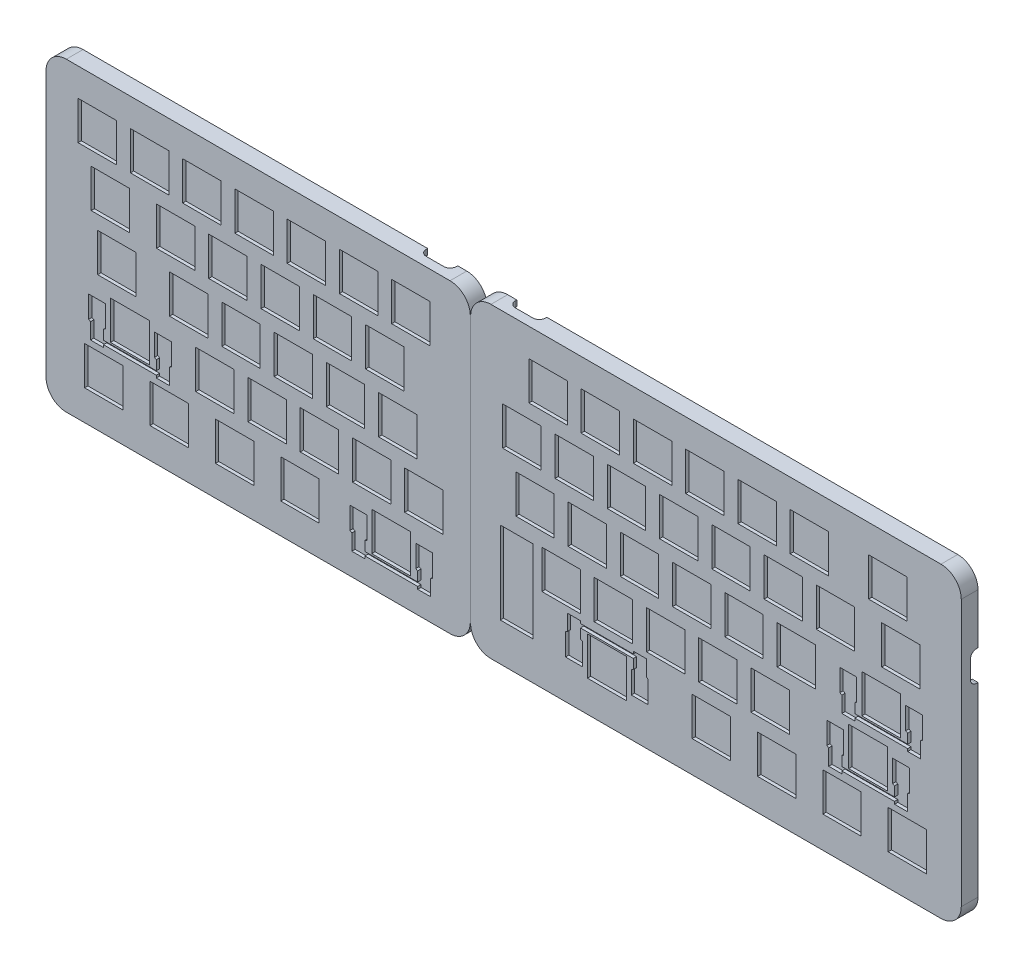
from build123d import *
from OCP.BRepAlgoAPI import BRepAlgoAPI_Cut
from OCP.TopTools import TopTools_ListOfShape

# Parameters (mm, degrees)
BOSS_EXTRUDE1_DEPTH                  = 1.2
BOSS_EXTRUDE1_2_DEPTH                = 1.2
SKETCH3_W                            = 14
SKETCH3_H                            = 14
CUT_EXTRUDE1_DEPTH                   = 1.2
BOSS_EXTRUDE2_DEPTH                  = 2.9
BOSS_EXTRUDE2_DEPTH_BACK             = 2
CUT_EXTRUDE2_DEPTH                   = 3.6
CUT_EXTRUDE3_DEPTH                   = 6
CUT_EXTRUDE4_START                   = -0.629226
CUT_EXTRUDE4_DEPTH                   = 2.133976
CUT_EXTRUDE5_DEPTH                   = 1.5
F_3_3_3_3_DIAMETER_HOLE1_AT_2_COUNT  = 2
F_3_3_3_3_DIAMETER_HOLE1_AT_2_PITCH  = 84.687594078
F_3_3_3_3_DIAMETER_HOLE1_AT_3_COUNT  = 2
F_3_3_3_3_DIAMETER_HOLE1_AT_3_PITCH  = 169.339250001
F_3_3_3_3_DIAMETER_HOLE1_AT_4_COUNT  = 2
F_3_3_3_3_DIAMETER_HOLE1_AT_4_PITCH  = 251.541091795
F_3_3_3_3_DIAMETER_HOLE1_AT_5_COUNT  = 2
F_3_3_3_3_DIAMETER_HOLE1_AT_5_PITCH  = 324.12
F_3_3_3_3_DIAMETER_HOLE1_AT_6_COUNT  = 2
F_3_3_3_3_DIAMETER_HOLE1_AT_6_PITCH  = 329.830375734
F_3_3_3_3_DIAMETER_HOLE1_AT_7_COUNT  = 2
F_3_3_3_3_DIAMETER_HOLE1_AT_7_PITCH  = 339.76617419
F_3_3_3_3_DIAMETER_HOLE1_AT_8_COUNT  = 2
F_3_3_3_3_DIAMETER_HOLE1_AT_8_PITCH  = 272.060494349
F_3_3_3_3_DIAMETER_HOLE1_AT_9_COUNT  = 2
F_3_3_3_3_DIAMETER_HOLE1_AT_9_PITCH  = 205.937809117
F_3_3_3_3_DIAMETER_HOLE1_AT_10_COUNT = 2
F_3_3_3_3_DIAMETER_HOLE1_AT_10_PITCH = 178.95
F_3_3_3_3_DIAMETER_HOLE1_AT_11_COUNT = 2
F_3_3_3_3_DIAMETER_HOLE1_AT_11_PITCH = 134.18391184
F_3_3_3_3_DIAMETER_HOLE1_AT_12_COUNT = 2
F_3_3_3_3_DIAMETER_HOLE1_AT_12_PITCH = 197.865862839
F_3_3_3_3_DIAMETER_HOLE1_AT_13_COUNT = 2
F_3_3_3_3_DIAMETER_HOLE1_AT_13_PITCH = 102.347999613
F_3_3_3_3_DIAMETER_HOLE1_AT_14_COUNT = 2
F_3_3_3_3_DIAMETER_HOLE1_AT_14_PITCH = 51.203766263
F_3_3_3_3_DIAMETER_HOLE1_AT_15_COUNT = 2
F_3_3_3_3_DIAMETER_HOLE1_AT_15_PITCH = 178.57853914
SKETCH11_W                           = 12.000000248
SKETCH11_H                           = 30
CUT_EXTRUDE_OLED_DEPTH               = 1.2
SKETCH13_W                           = 14.200000092
SKETCH13_H                           = 14.000000432
CUT_EXTRUDE6_DEPTH                   = 1.2
BOSS_EXTRUDE3_START                  = 1
BOSS_EXTRUDE3_DEPTH                  = 1


with BuildPart() as part:
    # Sketch2 → Boss-Extrude1 (new body)
    with BuildSketch(Plane.XY.offset(4.1)):
        with BuildLine():
            ThreePointArc((133.78, 95.545005864), (131.612590078, 100.777590078), (126.380005864, 102.945))
            Line((126.380005864, 102.945), (-13.490000824, 102.945))
            ThreePointArc((-13.490000824, 102.945), (-18.722587075, 100.77759308), (-20.89, 95.545009317))
            Line((-20.89, 95.545009317), (-20.89, -1.072999648))
            ThreePointArc((-20.89, -1.072999648), (-18.722593496, -6.305586659), (-13.490009317, -8.473))
            Line((-13.490009317, -8.473), (126.380000824, -8.473))
            ThreePointArc((126.380000824, -8.473), (131.612587075, -6.30559308), (133.78, -1.073009317))
            Line((133.78, -1.073009317), (133.78, 95.545005864))
        make_face()
    extrude(amount=-BOSS_EXTRUDE1_DEPTH)


with BuildPart() as body_2:
    # Sketch2 → Boss-Extrude1 2 (new body)
    with BuildSketch(Plane.XY.offset(4.1)):
        with BuildLine():
            ThreePointArc((141.290747469, 102.945), (136.058157566, 100.777589721), (133.89075, 95.544998695))
            Line((133.89075, 95.544998695), (133.89075002, -1.502703691))
            ThreePointArc((133.89075002, -1.502703691), (136.058071049, -6.735635188), (141.290974478, -8.903023987))
            Line((141.290974478, -8.903023987), (305.330003548, -8.903))
            ThreePointArc((305.330003548, -8.903), (310.562592793, -6.735589362), (312.73, -1.502998695))
            Line((312.73, -1.502998695), (312.73, 95.545002531))
            ThreePointArc((312.73, 95.545002531), (310.562589721, 100.777592434), (305.329998695, 102.945))
            Line((305.329998695, 102.945), (141.290747469, 102.945))
        make_face()
    extrude(amount=-BOSS_EXTRUDE1_2_DEPTH)


with BuildPart() as cut_extrude1_tool:
    # Sketch3 → Cut-Extrude1 (new body)
    with BuildSketch(Plane.XY.offset(4.1)):
        with Locations((245.45825, 9.525)):
            Rectangle(SKETCH3_W, SKETCH3_H)
        with Locations((221.64575, 9.525)):
            Rectangle(SKETCH3_W, SKETCH3_H)
        with Locations((183.54575, 9.525)):
            Rectangle(SKETCH3_W, SKETCH3_H)
        with Locations((78.767545, 28.582)):
            Rectangle(SKETCH3_W, SKETCH3_H)
        with Locations((293.08325, 9.525)):
            Rectangle(SKETCH3_W, SKETCH3_H)
        with Locations((269.27075, 9.525)):
            Rectangle(SKETCH3_W, SKETCH3_H)
        with Locations((97.817545, 28.582)):
            Rectangle(SKETCH3_W, SKETCH3_H)
        with Locations((283.55825, 47.625)):
            Rectangle(SKETCH3_W, SKETCH3_H)
        with Locations((166.877, 28.575)):
            Rectangle(SKETCH3_W, SKETCH3_H)
        with Locations((116.867545, 28.582)):
            Rectangle(SKETCH3_W, SKETCH3_H)
        with Locations((152.5895, 66.675)):
            Rectangle(SKETCH3_W, SKETCH3_H)
        with Locations((185.927, 28.575)):
            Rectangle(SKETCH3_W, SKETCH3_H)
        with Locations((4.948795, 47.632)):
            Rectangle(SKETCH3_W, SKETCH3_H)
        with Locations((171.6395, 66.675)):
            Rectangle(SKETCH3_W, SKETCH3_H)
        with Locations((204.977, 28.575)):
            Rectangle(SKETCH3_W, SKETCH3_H)
        with Locations((31.142545, 47.632)):
            Rectangle(SKETCH3_W, SKETCH3_H)
        with Locations((190.6895, 66.675)):
            Rectangle(SKETCH3_W, SKETCH3_H)
        with Locations((224.027, 28.575)):
            Rectangle(SKETCH3_W, SKETCH3_H)
        with Locations((50.192545, 47.632)):
            Rectangle(SKETCH3_W, SKETCH3_H)
        with Locations((228.7895, 66.675)):
            Rectangle(SKETCH3_W, SKETCH3_H)
        with Locations((209.7395, 66.675)):
            Rectangle(SKETCH3_W, SKETCH3_H)
        with Locations((243.077, 28.575)):
            Rectangle(SKETCH3_W, SKETCH3_H)
        with Locations((69.242545, 47.632)):
            Rectangle(SKETCH3_W, SKETCH3_H)
        with Locations((266.8895, 66.675)):
            Rectangle(SKETCH3_W, SKETCH3_H)
        with Locations((247.8395, 66.675)):
            Rectangle(SKETCH3_W, SKETCH3_H)
        with Locations((278.79575, 28.575)):
            Rectangle(SKETCH3_W, SKETCH3_H)
        with Locations((88.292545, 47.632)):
            Rectangle(SKETCH3_W, SKETCH3_H)
        with Locations((162.1145, 85.725)):
            Rectangle(SKETCH3_W, SKETCH3_H)
        with Locations((290.702, 66.675)):
            Rectangle(SKETCH3_W, SKETCH3_H)
        with Locations((107.342545, 47.632)):
            Rectangle(SKETCH3_W, SKETCH3_H)
        with Locations((200.2145, 85.725)):
            Rectangle(SKETCH3_W, SKETCH3_H)
        with Locations((181.1645, 85.725)):
            Rectangle(SKETCH3_W, SKETCH3_H)
        with Locations((2.567545, 66.682)):
            Rectangle(SKETCH3_W, SKETCH3_H)
        with Locations((238.3145, 85.725)):
            Rectangle(SKETCH3_W, SKETCH3_H)
        with Locations((219.2645, 85.725)):
            Rectangle(SKETCH3_W, SKETCH3_H)
        with Locations((157.352, 47.625)):
            Rectangle(SKETCH3_W, SKETCH3_H)
        with Locations((26.380045, 66.682)):
            Rectangle(SKETCH3_W, SKETCH3_H)
        with Locations((285.9395, 85.725)):
            Rectangle(SKETCH3_W, SKETCH3_H)
        with Locations((257.3645, 85.725)):
            Rectangle(SKETCH3_W, SKETCH3_H)
        with Locations((64.480045, 66.682)):
            Rectangle(SKETCH3_W, SKETCH3_H)
        with Locations((45.430045, 66.682)):
            Rectangle(SKETCH3_W, SKETCH3_H)
        with Locations((23.998795, 9.532)):
            Rectangle(SKETCH3_W, SKETCH3_H)
        with Locations((0.186295, 9.532)):
            Rectangle(SKETCH3_W, SKETCH3_H)
        with Locations((176.402, 47.625)):
            Rectangle(SKETCH3_W, SKETCH3_H)
        with Locations((102.580045, 66.682)):
            Rectangle(SKETCH3_W, SKETCH3_H)
        with Locations((83.530045, 66.682)):
            Rectangle(SKETCH3_W, SKETCH3_H)
        with Locations((71.687295, 9.532)):
            Rectangle(SKETCH3_W, SKETCH3_H)
        with Locations((47.874795, 9.532)):
            Rectangle(SKETCH3_W, SKETCH3_H)
        with Locations((16.855045, 85.732)):
            Rectangle(SKETCH3_W, SKETCH3_H)
        with Locations((-2.194955, 85.732)):
            Rectangle(SKETCH3_W, SKETCH3_H)
        with Locations((104.961295, 9.532)):
            Rectangle(SKETCH3_W, SKETCH3_H)
        with Locations((195.452, 47.625)):
            Rectangle(SKETCH3_W, SKETCH3_H)
        with Locations((54.955045, 85.732)):
            Rectangle(SKETCH3_W, SKETCH3_H)
        with Locations((35.905045, 85.732)):
            Rectangle(SKETCH3_W, SKETCH3_H)
        with Locations((9.711295, 28.582)):
            Rectangle(SKETCH3_W, SKETCH3_H)
        with Locations((112.105045, 85.732)):
            Rectangle(SKETCH3_W, SKETCH3_H)
        with Locations((93.055045, 85.732)):
            Rectangle(SKETCH3_W, SKETCH3_H)
        with Locations((74.005045, 85.732)):
            Rectangle(SKETCH3_W, SKETCH3_H)
        with Locations((59.717545, 28.582)):
            Rectangle(SKETCH3_W, SKETCH3_H)
        with Locations((40.667545, 28.582)):
            Rectangle(SKETCH3_W, SKETCH3_H)
        with Locations((252.602, 47.625)):
            Rectangle(SKETCH3_W, SKETCH3_H)
        with Locations((233.552, 47.625)):
            Rectangle(SKETCH3_W, SKETCH3_H)
        with Locations((214.502, 47.625)):
            Rectangle(SKETCH3_W, SKETCH3_H)
    extrude(amount=-CUT_EXTRUDE1_DEPTH)


with BuildPart() as part_1:
    add(part.part)

    # Cut-Extrude1: cut by cut_extrude1_tool
    add(cut_extrude1_tool.part, mode=Mode.SUBTRACT)


with BuildPart() as body_2_1:
    add(body_2.part)

    # Cut-Extrude1: cut by cut_extrude1_tool
    add(cut_extrude1_tool.part, mode=Mode.SUBTRACT)

    # Sketch4 → Boss-Extrude2 (add, two sides: drawn at the far end of the back side and taken through both)
    # profile 1 of 2: a face of its own
    with BuildSketch(Plane.XY.offset(-BOSS_EXTRUDE2_DEPTH_BACK)):
        with BuildLine():
            ThreePointArc((133.78, 95.545005864), (131.612590078, 100.777590078), (126.380005864, 102.945))
            Line((126.380005864, 102.945), (-13.490000824, 102.945))
            ThreePointArc((-13.490000824, 102.945), (-18.722587075, 100.77759308), (-20.89, 95.545009317))
            Line((-20.89, 95.545009317), (-20.89, -1.072999648))
            ThreePointArc((-20.89, -1.072999648), (-18.722593496, -6.305586659), (-13.490009317, -8.473))
            Line((-13.490009317, -8.473), (126.380000824, -8.473))
            ThreePointArc((126.380000824, -8.473), (131.612587075, -6.30559308), (133.78, -1.073009317))
            Line((133.78, -1.073009317), (133.78, 95.545005864))
        make_face()
        with BuildLine():
            Line((-13.490000824, 96.945), (126.380000824, 96.945))
            ThreePointArc((126.380000824, 96.945), (127.369949391, 96.534949391), (127.78, 95.545000824))
            Line((127.78, 95.545000824), (127.78, -1.073001477))
            ThreePointArc((127.78, -1.073001477), (127.36994916, -2.062949622), (126.380000824, -2.473))
            Line((126.380000824, -2.473), (-13.490001477, -2.473))
            ThreePointArc((-13.490001477, -2.473), (-14.479950037, -2.062948744), (-14.89, -1.072999648))
            Line((-14.89, -1.072999648), (-14.89, 95.545001477))
            ThreePointArc((-14.89, 95.545001477), (-14.47994916, 96.534949622), (-13.490000824, 96.945))
        make_face(mode=Mode.SUBTRACT)
    # profile 2 of 2: a face of its own
    with BuildSketch(Plane.XY.offset(-BOSS_EXTRUDE2_DEPTH_BACK)):
        with BuildLine():
            Line((305.329998695, 102.945), (141.290747469, 102.945))
            ThreePointArc((141.290747469, 102.945), (136.058157566, 100.777589721), (133.89075, 95.544998695))
            Line((133.89075, 95.544998695), (133.89075002, -1.502703691))
            ThreePointArc((133.89075002, -1.502703691), (136.058071049, -6.735635188), (141.290974478, -8.903023987))
            Line((141.290974478, -8.903023987), (305.330003548, -8.903))
            ThreePointArc((305.330003548, -8.903), (310.562592793, -6.735589362), (312.73, -1.502998695))
            Line((312.73, -1.502998695), (312.73, 95.545002531))
            ThreePointArc((312.73, 95.545002531), (310.562589721, 100.777592434), (305.329998695, 102.945))
        make_face()
        with BuildLine():
            Line((141.290747469, 96.945), (305.330002236, 96.945))
            ThreePointArc((305.330002236, 96.945), (306.319950286, 96.534950495), (306.73, 95.545002531))
            Line((306.73, 95.545002531), (306.73, -1.503002236))
            ThreePointArc((306.73, -1.503002236), (306.319950544, -2.492950237), (305.33000267, -2.903))
            Line((305.33000267, -2.903), (141.290693491, -2.903023998))
            ThreePointArc((141.290693491, -2.903023998), (140.300734781, -2.493017559), (139.890750002, -1.503049879))
            Line((139.890750002, -1.503049879), (139.89075, 95.545002236))
            ThreePointArc((139.89075, 95.545002236), (140.300799505, 96.534950286), (141.290747469, 96.945))
        make_face(mode=Mode.SUBTRACT)
    extrude(amount=BOSS_EXTRUDE2_DEPTH + BOSS_EXTRUDE2_DEPTH_BACK)


with BuildPart() as boss_extrude2_piece_1:
    # of the separate pieces the step leaves, piece 1, a body of its own (boss_extrude2_pieces)
    add(body_2_1.part.solids().sort_by_distance((141.290747469, 102.945, 4.1))[0])


with BuildPart() as boss_extrude2_piece_2:
    # of the separate pieces the step leaves, piece 2, a body of its own (boss_extrude2_pieces)
    add(body_2_1.part.solids().sort_by_distance((126.380000824, -8.473, 2.9))[0])


with BuildPart() as cut_extrude2_tool:
    # Sketch6 → Cut-Extrude2 (new body)
    with BuildSketch(Plane.XY.offset(1.6)):
        with BuildLine():
            Line((123.59, 96.945), (123.59, 99.945))
            ThreePointArc((123.59, 99.945), (123.297106391, 100.652106391), (122.59, 100.945))
            Line((122.59, 100.945), (112.590000667, 100.945))
            ThreePointArc((112.590000667, 100.945), (111.882893845, 100.652106626), (111.59, 99.945))
            Line((111.59, 99.945), (111.59, 96.945))
            Line((111.59, 96.945), (-13.490000824, 96.945))
            ThreePointArc((-13.490000824, 96.945), (-14.47994916, 96.534949622), (-14.89, 95.545001477))
            Line((-14.89, 95.545001477), (-14.89, 77.705))
            Line((-14.89, 77.705), (-17.889999333, 77.705))
            ThreePointArc((-17.889999333, 77.705), (-18.597106155, 77.412106626), (-18.89, 76.705))
            Line((-18.89, 76.705), (-18.89, 66.765000667))
            ThreePointArc((-18.89, 66.765000667), (-18.597106626, 66.057893845), (-17.89, 65.765))
            Line((-17.89, 65.765), (-14.89, 65.765))
            Line((-14.89, 65.765), (-14.89, -1.072999648))
            ThreePointArc((-14.89, -1.072999648), (-14.479950037, -2.062948744), (-13.490001477, -2.473))
            Line((-13.490001477, -2.473), (126.380000824, -2.473))
            ThreePointArc((126.380000824, -2.473), (127.36994916, -2.062949622), (127.78, -1.073001477))
            Line((127.78, -1.073001477), (127.78, 95.545000824))
            ThreePointArc((127.78, 95.545000824), (127.369949622, 96.53494916), (126.380001477, 96.945))
            Line((126.380001477, 96.945), (123.59, 96.945))
        make_face()
        with BuildLine():
            Line((156.08, 96.945), (156.08, 99.945))
            ThreePointArc((156.08, 99.945), (155.787106391, 100.652106391), (155.08, 100.945))
            Line((155.08, 100.945), (145.080000667, 100.945))
            ThreePointArc((145.080000667, 100.945), (144.372893845, 100.652106626), (144.08, 99.945))
            Line((144.08, 99.945), (144.08, 96.945))
            Line((144.08, 96.945), (141.290747469, 96.945))
            ThreePointArc((141.290747469, 96.945), (140.300799505, 96.534950286), (139.89075, 95.545002236))
            Line((139.89075, 95.545002236), (139.890750005, -1.503014757))
            ThreePointArc((139.890750005, -1.503014757), (140.300712315, -2.492995096), (141.290665073, -2.903024))
            Line((141.290665073, -2.903024), (305.33000267, -2.903))
            ThreePointArc((305.33000267, -2.903), (306.319950544, -2.492950237), (306.73, -1.503002236))
            Line((306.73, -1.503002236), (306.73, 65.765))
            Line((306.73, 65.765), (309.729999333, 65.765))
            ThreePointArc((309.729999333, 65.765), (310.437106155, 66.057893374), (310.73, 66.765))
            Line((310.73, 66.765), (310.73, 76.704999333))
            ThreePointArc((310.73, 76.704999333), (310.437106626, 77.412106155), (309.73, 77.705))
            Line((309.73, 77.705), (306.73, 77.705))
            Line((306.73, 77.705), (306.73, 95.545002531))
            ThreePointArc((306.73, 95.545002531), (306.319950286, 96.534950495), (305.330002236, 96.945))
            Line((305.330002236, 96.945), (156.08, 96.945))
        make_face()
    extrude(amount=-CUT_EXTRUDE2_DEPTH)


with BuildPart() as boss_extrude2_piece_1_1:
    add(boss_extrude2_piece_1.part)

    # Cut-Extrude2: cut by cut_extrude2_tool, with a tolerance
    cut_extrude2_stock = TopTools_ListOfShape()
    cut_extrude2_stock.Append(boss_extrude2_piece_1_1.part.wrapped)
    cut_extrude2_tools = TopTools_ListOfShape()
    cut_extrude2_tools.Append(cut_extrude2_tool.part.wrapped)
    cut_extrude2_cut = BRepAlgoAPI_Cut()
    cut_extrude2_cut.SetArguments(cut_extrude2_stock)
    cut_extrude2_cut.SetTools(cut_extrude2_tools)
    cut_extrude2_cut.SetFuzzyValue(0.00001)
    cut_extrude2_cut.Build()
    add(Compound.cast(cut_extrude2_cut.Shape()).solids(), mode=Mode.REPLACE)

    # Sketch7 → Cut-Extrude3 (cut)
    with BuildSketch(Plane(origin=(312.73, 0, 0), x_dir=(0, 0, -1), z_dir=(1, 0, 0))):
        with BuildLine():
            Line((1.485, 66.265), (2, 66.265))
            Line((2, 66.265), (2, 77.205))
            Line((2, 77.205), (1.485, 77.205))
            ThreePointArc((1.485, 77.205), (-0.105990258, 76.545990258), (-0.765, 74.955))
            Line((-0.765, 74.955), (-0.765, 73.003244897))
            Line((-0.765, 73.003244897), (-0.765, 71.023244897))
            Line((-0.765, 71.023244897), (-0.765, 68.515))
            ThreePointArc((-0.765, 68.515), (-0.105990258, 66.924009742), (1.485, 66.265))
        make_face()
        with BuildLine():
            ThreePointArc((2.145, 66.265), (3.735990258, 66.924009742), (4.395, 68.515))
            Line((4.395, 68.515), (4.395, 74.955))
            ThreePointArc((4.395, 74.955), (3.735990258, 76.545990258), (2.145, 77.205))
            Line((2.145, 77.205), (2, 77.205))
            Line((2, 77.205), (2, 66.265))
            Line((2, 66.265), (2.145, 66.265))
        make_face()
    extrude(amount=-CUT_EXTRUDE3_DEPTH, mode=Mode.SUBTRACT)


with BuildPart() as boss_extrude2_piece_2_1:
    add(boss_extrude2_piece_2.part)

    # Cut-Extrude2: cut by cut_extrude2_tool, with a tolerance
    cut_extrude2_2_stock = TopTools_ListOfShape()
    cut_extrude2_2_stock.Append(boss_extrude2_piece_2_1.part.wrapped)
    cut_extrude2_2_tools = TopTools_ListOfShape()
    cut_extrude2_2_tools.Append(cut_extrude2_tool.part.wrapped)
    cut_extrude2_2_cut = BRepAlgoAPI_Cut()
    cut_extrude2_2_cut.SetArguments(cut_extrude2_2_stock)
    cut_extrude2_2_cut.SetTools(cut_extrude2_2_tools)
    cut_extrude2_2_cut.SetFuzzyValue(0.00001)
    cut_extrude2_2_cut.Build()
    add(Compound.cast(cut_extrude2_2_cut.Shape()).solids(), mode=Mode.REPLACE)


with BuildPart() as part_2:
    add(part_1.part)

    # Combine1: union Boss-Extrude2 piece 2
    add(boss_extrude2_piece_2_1.part)

    # Sketch8 → Cut-Extrude4 (cut)
    with BuildSketch(Plane.ZY.offset(19.38525).offset(CUT_EXTRUDE4_START)):
        with BuildLine():
            Line((0.765, 71.466755103), (0.765, 74.955))
            ThreePointArc((0.765, 74.955), (0.105990258, 76.545990258), (-1.485, 77.205))
            Line((-1.485, 77.205), (-2.145, 77.205))
            ThreePointArc((-2.145, 77.205), (-3.735990258, 76.545990258), (-4.395, 74.955))
            Line((-4.395, 74.955), (-4.395, 68.515))
            ThreePointArc((-4.395, 68.515), (-3.735990258, 66.924009742), (-2.145, 66.265))
            Line((-2.145, 66.265), (-1.485, 66.265))
            ThreePointArc((-1.485, 66.265), (0.105990258, 66.924009742), (0.765, 68.515))
            Line((0.765, 68.515), (0.765, 71.446755103))
            Line((0.765, 71.446755103), (0.765, 71.466755103))
        make_face()
    extrude(amount=CUT_EXTRUDE4_DEPTH, mode=Mode.SUBTRACT)


with BuildPart() as cut_extrude5_tool:
    # Sketch9 → Cut-Extrude5 (new, symmetric)
    with BuildSketch(Plane(origin=(0, 101.445, 0), x_dir=(1, 0, 0), z_dir=(0, 1, 0))):
        with BuildLine():
            Line((146.86, -0.765), (153.3, -0.765))
            ThreePointArc((153.3, -0.765), (154.890990258, -0.105990258), (155.55, 1.485))
            Line((155.55, 1.485), (155.55, 2.145))
            ThreePointArc((155.55, 2.145), (154.890990258, 3.735990258), (153.3, 4.395))
            Line((153.3, 4.395), (146.86, 4.395))
            ThreePointArc((146.86, 4.395), (145.269009742, 3.735990258), (144.61, 2.145))
            Line((144.61, 2.145), (144.61, 1.485))
            ThreePointArc((144.61, 1.485), (145.269009742, -0.105990258), (146.86, -0.765))
        make_face()
        with BuildLine():
            ThreePointArc((123.06, 2.145), (122.400990258, 3.735990258), (120.81, 4.395))
            Line((120.81, 4.395), (114.37, 4.395))
            ThreePointArc((114.37, 4.395), (112.779009742, 3.735990258), (112.12, 2.145))
            Line((112.12, 2.145), (112.12, 1.485))
            ThreePointArc((112.12, 1.485), (112.779009742, -0.105990258), (114.37, -0.765))
            Line((114.37, -0.765), (120.81, -0.765))
            ThreePointArc((120.81, -0.765), (122.400990258, -0.105990258), (123.06, 1.485))
            Line((123.06, 1.485), (123.06, 2.145))
        make_face()
    extrude(amount=CUT_EXTRUDE5_DEPTH, both=True)


with BuildPart() as part_3:
    add(part_2.part)

    # Cut-Extrude5: cut by cut_extrude5_tool
    add(cut_extrude5_tool.part, mode=Mode.SUBTRACT)


with BuildPart() as boss_extrude2_piece_1_2:
    add(boss_extrude2_piece_1_1.part)

    # Cut-Extrude5: cut by cut_extrude5_tool
    add(cut_extrude5_tool.part, mode=Mode.SUBTRACT)

    # Sketch10 → Ø3.3 (3.3) Diameter Hole1 (revolve, cut)
    with BuildSketch(Plane(origin=(307.98, 98.195, -2), x_dir=(0, 1, 0), z_dir=(1, 0, 0))):
        Polygon((0, 0), (0, 4), (1.65, 3.008579979), (1.65, 0), align=None)
    f_3_3_3_3_diameter_hole1 = revolve(axis=Axis((307.98, 98.195, -8.35), (0, 0, 1)), mode=Mode.SUBTRACT)

    # Ø3.3 (3.3) Diameter Hole1 at 2: Ø3.3 (3.3) Diameter Hole1 ×2
    with Locations(*[Vector(-0.9997864729593883, 0.020664183686428278, 0) * (i * F_3_3_3_3_DIAMETER_HOLE1_AT_2_PITCH) for i in range(1, F_3_3_3_3_DIAMETER_HOLE1_AT_2_COUNT)]):
        add(f_3_3_3_3_diameter_hole1, mode=Mode.SUBTRACT)

    # Ø3.3 (3.3) Diameter Hole1 at 3: Ø3.3 (3.3) Diameter Hole1 ×2
    with Locations(*[(-i * F_3_3_3_3_DIAMETER_HOLE1_AT_3_PITCH, 0, 0) for i in range(1, F_3_3_3_3_DIAMETER_HOLE1_AT_3_COUNT)]):
        add(f_3_3_3_3_diameter_hole1, mode=Mode.SUBTRACT)

    # Ø3.3 (3.3) Diameter Hole1 at 11: Ø3.3 (3.3) Diameter Hole1 ×2
    with Locations(*[Vector(-0.6309959953878045, -0.7757860876585465, 0) * (i * F_3_3_3_3_DIAMETER_HOLE1_AT_11_PITCH) for i in range(1, F_3_3_3_3_DIAMETER_HOLE1_AT_11_COUNT)]):
        add(f_3_3_3_3_diameter_hole1, mode=Mode.SUBTRACT)

    # Ø3.3 (3.3) Diameter Hole1 at 12: Ø3.3 (3.3) Diameter Hole1 ×2
    with Locations(*[Vector(-0.8558285272149775, -0.5172596369378173, 0) * (i * F_3_3_3_3_DIAMETER_HOLE1_AT_12_PITCH) for i in range(1, F_3_3_3_3_DIAMETER_HOLE1_AT_12_COUNT)]):
        add(f_3_3_3_3_diameter_hole1, mode=Mode.SUBTRACT)

    # Ø3.3 (3.3) Diameter Hole1 at 13: Ø3.3 (3.3) Diameter Hole1 ×2
    with Locations(*[(0, -i * F_3_3_3_3_DIAMETER_HOLE1_AT_13_PITCH, 0) for i in range(1, F_3_3_3_3_DIAMETER_HOLE1_AT_13_COUNT)]):
        add(f_3_3_3_3_diameter_hole1, mode=Mode.SUBTRACT)

    # Ø3.3 (3.3) Diameter Hole1 at 14: Ø3.3 (3.3) Diameter Hole1 ×2
    with Locations(*[Vector(0.03417717343321745, -0.9994157897572541, 0) * (i * F_3_3_3_3_DIAMETER_HOLE1_AT_14_PITCH) for i in range(1, F_3_3_3_3_DIAMETER_HOLE1_AT_14_COUNT)]):
        add(f_3_3_3_3_diameter_hole1, mode=Mode.SUBTRACT)

    # Ø3.3 (3.3) Diameter Hole1 at 15: Ø3.3 (3.3) Diameter Hole1 ×2
    with Locations(*[Vector(-0.9580616507089157, -0.286562163310001, 0) * (i * F_3_3_3_3_DIAMETER_HOLE1_AT_15_PITCH) for i in range(1, F_3_3_3_3_DIAMETER_HOLE1_AT_15_COUNT)]):
        add(f_3_3_3_3_diameter_hole1, mode=Mode.SUBTRACT)

    # Sketch11 → Cut-Extrude_oled (cut)
    with BuildSketch(Plane.XY.offset(4.1)):
        with Locations((150.690735793, 19.996978253)):
            Rectangle(SKETCH11_W, SKETCH11_H)
    extrude(amount=-CUT_EXTRUDE_OLED_DEPTH, mode=Mode.SUBTRACT)


with BuildPart() as part_4:
    add(part_3.part)

    # Ø3.3 (3.3) Diameter Hole1 at 4: Ø3.3 (3.3) Diameter Hole1 ×2
    with Locations(*[Vector(-0.9999757989909713, 0.006957113795858436, 0) * (i * F_3_3_3_3_DIAMETER_HOLE1_AT_4_PITCH) for i in range(1, F_3_3_3_3_DIAMETER_HOLE1_AT_4_COUNT)]):
        add(f_3_3_3_3_diameter_hole1, mode=Mode.SUBTRACT)

    # Ø3.3 (3.3) Diameter Hole1 at 5: Ø3.3 (3.3) Diameter Hole1 ×2
    with Locations(*[(-i * F_3_3_3_3_DIAMETER_HOLE1_AT_5_PITCH, 0, 0) for i in range(1, F_3_3_3_3_DIAMETER_HOLE1_AT_5_COUNT)]):
        add(f_3_3_3_3_diameter_hole1, mode=Mode.SUBTRACT)

    # Ø3.3 (3.3) Diameter Hole1 at 6: Ø3.3 (3.3) Diameter Hole1 ×2
    with Locations(*[Vector(-0.9879926894986677, -0.15450063267569233, 0) * (i * F_3_3_3_3_DIAMETER_HOLE1_AT_6_PITCH) for i in range(1, F_3_3_3_3_DIAMETER_HOLE1_AT_6_COUNT)]):
        add(f_3_3_3_3_diameter_hole1, mode=Mode.SUBTRACT)

    # Ø3.3 (3.3) Diameter Hole1 at 7: Ø3.3 (3.3) Diameter Hole1 ×2
    with Locations(*[Vector(-0.9539501710913169, -0.2999651164299733, 0) * (i * F_3_3_3_3_DIAMETER_HOLE1_AT_7_PITCH) for i in range(1, F_3_3_3_3_DIAMETER_HOLE1_AT_7_COUNT)]):
        add(f_3_3_3_3_diameter_hole1, mode=Mode.SUBTRACT)

    # Ø3.3 (3.3) Diameter Hole1 at 8: Ø3.3 (3.3) Diameter Hole1 ×2
    with Locations(*[Vector(-0.924555418634432, -0.3810476057839888, 0) * (i * F_3_3_3_3_DIAMETER_HOLE1_AT_8_PITCH) for i in range(1, F_3_3_3_3_DIAMETER_HOLE1_AT_8_COUNT)]):
        add(f_3_3_3_3_diameter_hole1, mode=Mode.SUBTRACT)

    # Ø3.3 (3.3) Diameter Hole1 at 9: Ø3.3 (3.3) Diameter Hole1 ×2
    with Locations(*[Vector(-0.8689516547111712, -0.49489698097151247, 0) * (i * F_3_3_3_3_DIAMETER_HOLE1_AT_9_PITCH) for i in range(1, F_3_3_3_3_DIAMETER_HOLE1_AT_9_COUNT)]):
        add(f_3_3_3_3_diameter_hole1, mode=Mode.SUBTRACT)

    # Ø3.3 (3.3) Diameter Hole1 at 10: Ø3.3 (3.3) Diameter Hole1 ×2
    with Locations(*[(-i * F_3_3_3_3_DIAMETER_HOLE1_AT_10_PITCH, 0, 0) for i in range(1, F_3_3_3_3_DIAMETER_HOLE1_AT_10_COUNT)]):
        add(f_3_3_3_3_diameter_hole1, mode=Mode.SUBTRACT)


with BuildPart() as cut_extrude6_tool:
    # Sketch13 → Cut-Extrude6 (new body)
    with BuildSketch(Plane.XY.offset(4.1)):
        Polygon((19.336294902, 18.701099833), (24.086295215, 18.701099833), (24.086295215, 24.493068033), (24.786294957, 24.893068052), (24.786294957, 32.901099925), (18.636295159, 32.901099925), (18.636295159, 24.893068052), (19.336294902, 24.493068033), (19.336294902, 21.001100117), (0.086295006, 21.001100117), (0.086295006, 24.493068033), (0.786294748, 24.893068052), (0.786294748, 32.901099925), (-5.363705049, 32.901099925), (-5.363705049, 24.893068052), (-4.663705307, 24.493068033), (-4.663705307, 18.701099833), (0.086295006, 18.701099833), (0.086295006, 19.601100167), (19.336294902, 19.601100167), align=None)
        with Locations((9.711294954, 28.582000216)):
            Rectangle(SKETCH13_W, SKETCH13_H)
        Polygon((288.420749902, 18.694099833), (293.170750215, 18.694099833), (293.170750215, 24.486068033), (293.870749957, 24.886068052), (293.870749957, 32.894099925), (287.720750159, 32.894099925), (287.720750159, 24.886068052), (288.420749902, 24.486068033), (288.420749902, 20.994100117), (269.170750006, 20.994100117), (269.170750006, 24.486068033), (269.870749748, 24.886068052), (269.870749748, 32.894099925), (263.720749951, 32.894099925), (263.720749951, 24.886068052), (264.420749693, 24.486068033), (264.420749693, 18.694099833), (269.170750006, 18.694099833), (269.170750006, 19.594100167), (288.420749902, 19.594100167), align=None)
        with Locations((278.795749954, 28.575000216)):
            Rectangle(SKETCH13_W, SKETCH13_H)
        Polygon((293.183249902, 37.744099833), (297.933250215, 37.744099833), (297.933250215, 43.536068033), (298.633249957, 43.936068052), (298.633249957, 51.944099925), (292.483250159, 51.944099925), (292.483250159, 43.936068052), (293.183249902, 43.536068033), (293.183249902, 40.044100117), (273.933250006, 40.044100117), (273.933250006, 43.536068033), (274.633249748, 43.936068052), (274.633249748, 51.944099925), (268.483249951, 51.944099925), (268.483249951, 43.936068052), (269.183249693, 43.536068033), (269.183249693, 37.744099833), (273.933250006, 37.744099833), (273.933250006, 38.644100167), (293.183249902, 38.644100167), align=None)
        with Locations((283.558249954, 47.625000216)):
            Rectangle(SKETCH13_W, SKETCH13_H)
        Polygon((173.920750006, 19.405900167), (169.170749693, 19.405900167), (169.170749693, 13.613931967), (168.470749951, 13.213931948), (168.470749951, 5.205900075), (174.620749748, 5.205900075), (174.620749748, 13.213931948), (173.920750006, 13.613931967), (173.920750006, 17.105899883), (193.170749902, 17.105899883), (193.170749902, 13.613931967), (192.470750159, 13.213931948), (192.470750159, 5.205900075), (198.620749957, 5.205900075), (198.620749957, 13.213931948), (197.920750215, 13.613931967), (197.920750215, 19.405900167), (193.170749902, 19.405900167), (193.170749902, 18.505899833), (173.920750006, 18.505899833), align=None)
        with Locations((183.545749954, 9.524999784)):
            Rectangle(SKETCH13_W, SKETCH13_H)
        Polygon((114.586294902, -0.348900167), (119.336295215, -0.348900167), (119.336295215, 5.443068033), (120.036294957, 5.843068052), (120.036294957, 13.851099925), (113.886295159, 13.851099925), (113.886295159, 5.843068052), (114.586294902, 5.443068033), (114.586294902, 1.951100117), (95.336295006, 1.951100117), (95.336295006, 5.443068033), (96.036294748, 5.843068052), (96.036294748, 13.851099925), (89.886294951, 13.851099925), (89.886294951, 5.843068052), (90.586294693, 5.443068033), (90.586294693, -0.348900167), (95.336295006, -0.348900167), (95.336295006, 0.551100167), (114.586294902, 0.551100167), align=None)
        with Locations((104.961294954, 9.532000216)):
            Rectangle(SKETCH13_W, SKETCH13_H)
    extrude(amount=-CUT_EXTRUDE6_DEPTH)


with BuildPart() as part_5:
    add(part_4.part)

    # Cut-Extrude6: cut by cut_extrude6_tool
    add(cut_extrude6_tool.part, mode=Mode.SUBTRACT)



with BuildPart() as boss_extrude2_piece_1_3:
    add(boss_extrude2_piece_1_2.part)

    # Cut-Extrude6: cut by cut_extrude6_tool
    add(cut_extrude6_tool.part, mode=Mode.SUBTRACT)


with BuildPart() as part_6:
    add(part_5.part)

    add(boss_extrude2_piece_1_3.part)  # Boss-Extrude3 merges Boss-Extrude2 piece 1
    # Sketch14 → Boss-Extrude3 (add)
    with BuildSketch(Plane(origin=(0, 0, 2.9), x_dir=(-1, 0, 0), z_dir=(0, 0, -1)).offset(BOSS_EXTRUDE3_START)):
        with BuildLine():
            Line((-127.78, 95.544999648), (-127.78, -1.072999648))
            ThreePointArc((-127.78, -1.072999648), (-127.369949806, -2.062948975), (-126.380000824, -2.473))
            Line((-126.380000824, -2.473), (13.490001477, -2.473))
            ThreePointArc((13.490001477, -2.473), (14.479950037, -2.062948744), (14.89, -1.072999648))
            Line((14.89, -1.072999648), (14.89, 95.545001477))
            ThreePointArc((14.89, 95.545001477), (14.47994916, 96.534949622), (13.490000824, 96.945))
            Line((13.490000824, 96.945), (-126.380000824, 96.945))
            ThreePointArc((-126.380000824, 96.945), (-127.369949806, 96.534948975), (-127.78, 95.544999648))
        make_face()
        with BuildLine():
            Line((-306.73, 95.545003062), (-306.73, -1.503003062))
            ThreePointArc((-306.73, -1.503003062), (-306.319950252, -2.492950529), (-305.33000267, -2.903))
            Line((-305.33000267, -2.903), (-141.290693491, -2.903023998))
            ThreePointArc((-141.290693491, -2.903023998), (-140.30073478, -2.49301756), (-139.890750002, -1.503049879))
            Line((-139.890750002, -1.503049879), (-139.89075, 95.545002236))
            ThreePointArc((-139.89075, 95.545002236), (-140.300799505, 96.534950286), (-141.290747469, 96.945))
            Line((-141.290747469, 96.945), (-305.330002236, 96.945))
            ThreePointArc((-305.330002236, 96.945), (-306.319950098, 96.534950683), (-306.73, 95.545003062))
        make_face()
    extrude(amount=-BOSS_EXTRUDE3_DEPTH)


solid = part_6.part
